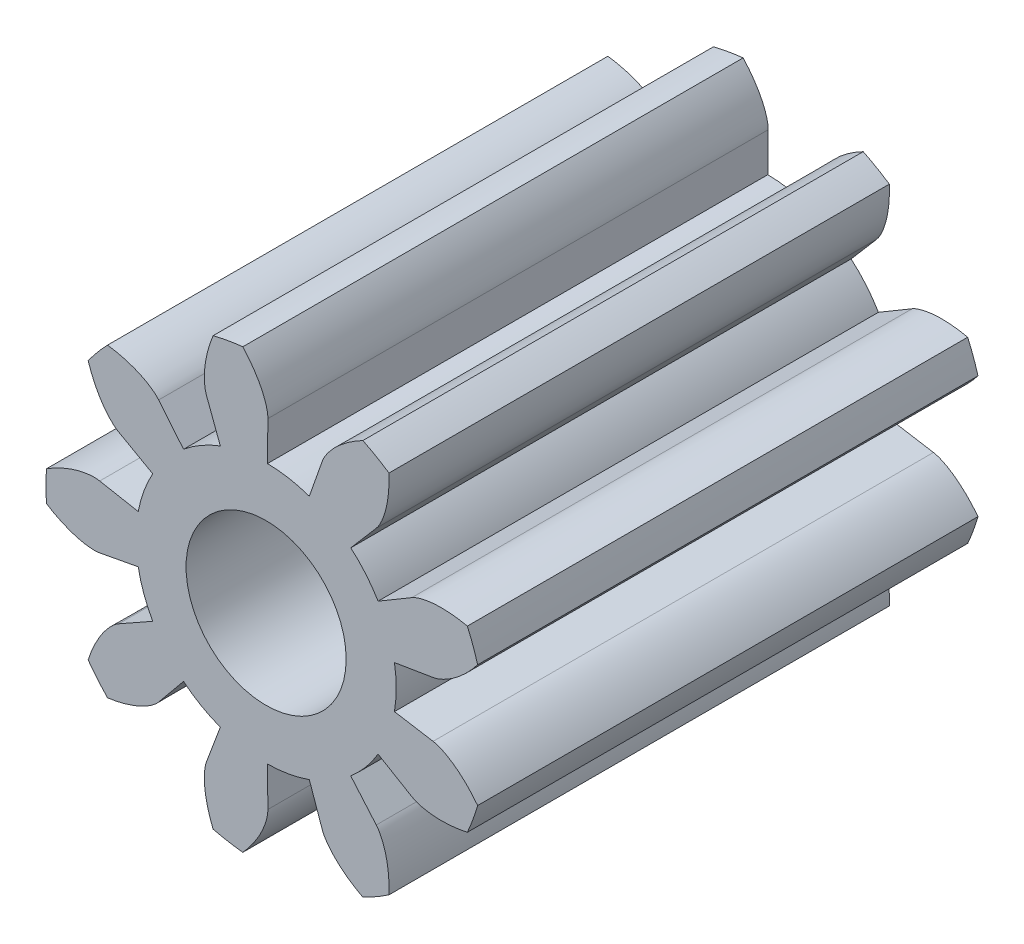
from build123d import *

# Parameters (mm, degrees)
SKETCH_1_R               = 1.1
SKETCH_1_R_2             = 0.4
EXTRUDE_1_DEPTH          = 2.5
CUT_EXTRUDE_1_DEPTH      = 3.944486373
PATTERN_CIRCULAR_1_COUNT = 9
PATTERN_CIRCULAR_1_ANGLE = 320


with BuildPart() as part:
    # 草图1 → 凸台-拉伸1 (new body)
    with BuildSketch(Plane.XY):
        Circle(SKETCH_1_R)
        Circle(SKETCH_1_R_2, mode=Mode.SUBTRACT)
    extrude(amount=EXTRUDE_1_DEPTH)

    # 草图1<3> → 切除-拉伸1 (cut, through all)
    with BuildSketch(Plane.XY):
        with BuildLine():
            Line((0.834372946, 0.138093396), (0.641276381, 0.106134833))
            ThreePointArc((0.641276381, 0.106134833), (0.647815424, 0.053246372), (0.65, 0))
            ThreePointArc((0.65, 0), (0.647815424, -0.053246372), (0.641276381, -0.106134833))
            Line((0.641276381, -0.106134833), (0.834372946, -0.138093396))
            add(Edge.make_bspline(
                [(0.834372946, -0.138093396), (0.840733145, -0.139146045), (0.858263666, -0.143405528), (0.890201748, -0.156704726), (0.938512577, -0.185155263), (0.988468678, -0.226228992), (1.02486759, -0.264566247), (1.047926422, -0.292762426), (1.05700399, -0.304536641)],
                knots=[0, 0, 0, 0, 0, 0.005604068, 0.015718248, 0.029959916, 0.048733667, 0.061688794, 0.061688794, 0.061688794, 0.061688794, 0.061688794], degree=4))
            ThreePointArc((1.05700399, -0.304536641), (1.089197959, -0.15377843), (1.1, 0))
            ThreePointArc((1.1, 0), (1.089197959, 0.15377843), (1.05700399, 0.304536641))
            add(Edge.make_bspline(
                [(0.834372946, 0.138093396), (0.840733145, 0.139146045), (0.858263666, 0.143405528), (0.890201748, 0.156704726), (0.938512577, 0.185155263), (0.988468678, 0.226228992), (1.02486759, 0.264566247), (1.047926422, 0.292762426), (1.05700399, 0.304536641)],
                knots=[0, 0, 0, 0, 0, 0.005604068, 0.015718248, 0.029959916, 0.048733667, 0.061688794, 0.061688794, 0.061688794, 0.061688794, 0.061688794], degree=4))
        make_face()
    cut_extrude_1 = extrude(amount=CUT_EXTRUDE_1_DEPTH, mode=Mode.SUBTRACT)

    # 阵列(圆周)1: 切除-拉伸1 ×9 about axis
    pattern_circular_1_axis = Axis((0, 0, 2.5), (0, 0, 1))
    for i in range(1, PATTERN_CIRCULAR_1_COUNT):
        add(cut_extrude_1.rotate(pattern_circular_1_axis, i * PATTERN_CIRCULAR_1_ANGLE / (PATTERN_CIRCULAR_1_COUNT - 1)), mode=Mode.SUBTRACT)


solid = part.part
